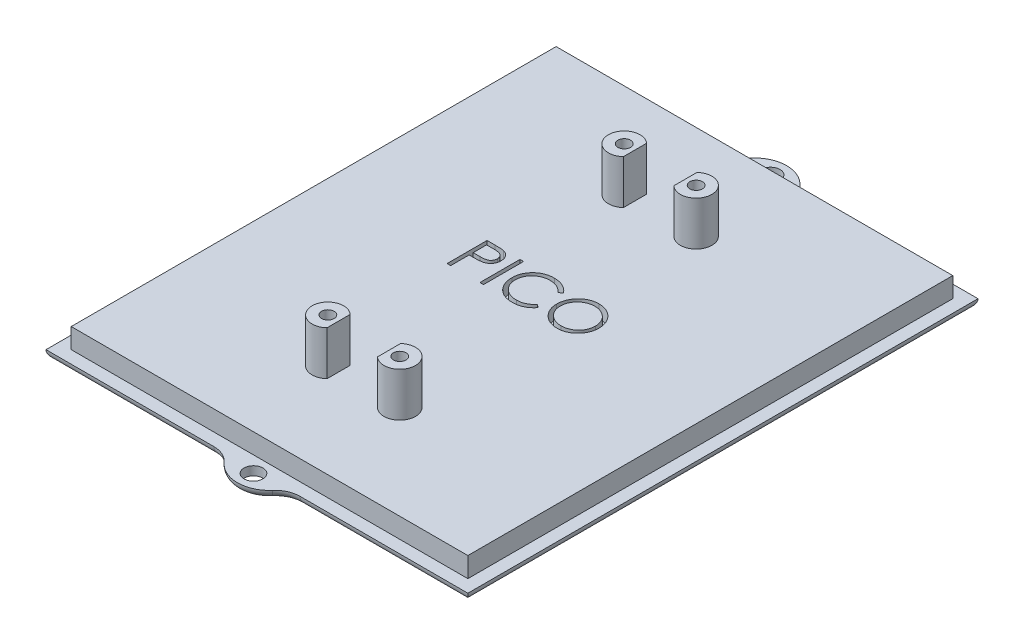
from build123d import *

# Parameters (mm, degrees)
SKETCH1_W           = 62.9
SKETCH1_H           = 76.9
BOSS_EXTRUDE1_DEPTH = 4.575
SKETCH11_W          = 66.9
SKETCH11_H          = 80.9
BOSS_EXTRUDE5_DEPTH = 1.4
BOSS_EXTRUDE3_DEPTH = 1.4
CUT_EXTRUDE3_REACH  = 57.005
SKETCH12_R          = 1.5
FILLET1_R           = 1.4
SKETCH2_R           = 2.5
SKETCH2_R_2         = 1
SCREW_HOLES_DEPTH   = 7
CUT_EXTRUDE1_START  = -3.575
SKETCH3_R           = 1
CUT_EXTRUDE1_DEPTH  = 3.575
SKETCH5_W           = 0.569871795
SKETCH5_H           = 6.35
LETTERS_DEPTH       = 2
SKETCH7_W           = 8
SKETCH7_H           = 52
CUT_EXTRUDE2_DEPTH  = 7


with BuildPart() as part:
    # Sketch1 → Boss-Extrude1 (new body)
    with BuildSketch(Plane(origin=(0, 0, 0), x_dir=(1, 0, 0), z_dir=(0, 1, 0))):
        Rectangle(SKETCH1_W, SKETCH1_H)
    extrude(amount=BOSS_EXTRUDE1_DEPTH)

    # Sketch11 → Boss-Extrude5 (add)
    with BuildSketch(Plane(origin=(0, 0, 0), x_dir=(-1, 0, 0), z_dir=(0, -1, 0))):
        Rectangle(SKETCH11_W, SKETCH11_H)
    extrude(amount=-BOSS_EXTRUDE5_DEPTH)

    # Sketch4 → Boss-Extrude3 (add)
    with BuildSketch(Plane(origin=(0, 0, 0), x_dir=(1, 0, 0), z_dir=(0, 1, 0))):
        with BuildLine():
            Line((-6.841783393, -40.45), (6.841783393, -40.45))
            ThreePointArc((6.841783393, -40.45), (5.190942782, -40.806550361), (3.834406078, -41.812637363))
            ThreePointArc((3.834406078, -41.812637363), (0, -43.55), (-3.834406078, -41.812637363))
            ThreePointArc((-3.834406078, -41.812637363), (-5.190942782, -40.806550361), (-6.841783393, -40.45))
        make_face()
    boss_extrude3 = extrude(amount=BOSS_EXTRUDE3_DEPTH)

    # Sketch12 → Cut-Extrude3 (cut, up to next)
    with BuildSketch(Plane(origin=(0, 1.4, 0), x_dir=(1, 0, 0), z_dir=(0, 1, 0)), mode=Mode.PRIVATE) as cut_extrude3_sk1:
        with Locations(Location((0, -41, 0), (0, 0, 270))):
            Circle(SKETCH12_R)
    cut_extrude3_tool1 = extrude(cut_extrude3_sk1.sketch, amount=-CUT_EXTRUDE3_REACH, mode=Mode.PRIVATE) & part.part
    cut_extrude3 = cut_extrude3_tool1.solids().sort_by_distance((0, 1.4, 41))[0]
    add(cut_extrude3, mode=Mode.SUBTRACT)

    # Mirror1: Boss-Extrude3, Cut-Extrude3 across plane
    add(boss_extrude3.mirror(Plane.XY))
    add(cut_extrude3.mirror(Plane.XY), mode=Mode.SUBTRACT)

    # Fillet1
    # the kernel refuses this fillet: 1.4 mm, written as the material it takes off along each edge
    with BuildSketch(Plane(origin=(6.841783393, 0, -40.45), x_dir=(0, 0, 1), z_dir=(1, 0, 0)), Plane(origin=(-36.95, 0, -40.45), x_dir=(0, 0, 1), z_dir=(1, 0, 0)), Plane(origin=(-6.841783393, 0, 40.45), x_dir=(0, 0, -1), z_dir=(-1, 0, 0)), Plane(origin=(36.95, 0, 40.45), x_dir=(0, 0, -1), z_dir=(-1, 0, 0))) as fillet1_piece_1:
        with BuildLine():
            CenterArc((FILLET1_R, -FILLET1_R), FILLET1_R, 90, 90)
            Line((0, -FILLET1_R), (0, 0))
            Line((0, 0), (FILLET1_R, 0))
        make_face()
    extrude(amount=30.108216607, mode=Mode.SUBTRACT)
    with BuildSketch(Plane(origin=(6.841783393, 0, -44.45), x_dir=(0, 0, 1), z_dir=(1, 0, 0))) as fillet1_piece_2:
        with BuildLine():
            CenterArc((4 + FILLET1_R, -FILLET1_R), FILLET1_R, 90, 90)
            Line((4, -FILLET1_R), (4, 0))
            Line((4, 0), (4 + FILLET1_R, 0))
        make_face()
    revolve(axis=Axis((6.841783393, 0, -44.45), (0, -1, 0)), revolution_arc=48.750392906, mode=Mode.SUBTRACT)
    with BuildSketch(Plane(origin=(0, 0, -38.45), x_dir=(0.7518443289273548, 0, -0.6593406593406594), z_dir=(0.6593406593406594, 0, 0.7518443289273548))) as fillet1_piece_3:
        with BuildLine():
            CenterArc((5.1 - FILLET1_R, FILLET1_R), FILLET1_R, 270, 90)
            Line((5.1, FILLET1_R), (5.1, 0))
            Line((5.1, 0), (5.1 - FILLET1_R, 0))
        make_face()
    revolve(axis=Axis((0, 0, -38.45), (0, 1, 0)), revolution_arc=97.500785812, mode=Mode.SUBTRACT)
    with BuildSketch(Plane(origin=(-6.841783393, 0, -44.45), x_dir=(0.7518443289273578, 0, 0.6593406593406562), z_dir=(0.6593406593406562, 0, -0.7518443289273578))) as fillet1_piece_4:
        with BuildLine():
            CenterArc((4 + FILLET1_R, -FILLET1_R), FILLET1_R, 90, 90)
            Line((4, -FILLET1_R), (4, 0))
            Line((4, 0), (4 + FILLET1_R, 0))
        make_face()
    revolve(axis=Axis((-6.841783393, 0, -44.45), (0, -1, 0)), revolution_arc=48.750392906, mode=Mode.SUBTRACT)
    with BuildSketch(Plane(origin=(-33.45, 0, 43.95), x_dir=(1, 0, 0), z_dir=(0, 0, -1)), Plane(origin=(33.45, 0, -43.95), x_dir=(-1, 0, 0), z_dir=(0, 0, 1))) as fillet1_piece_5:
        with BuildLine():
            CenterArc((FILLET1_R, -FILLET1_R), FILLET1_R, 90, 90)
            Line((0, -FILLET1_R), (0, 0))
            Line((0, 0), (FILLET1_R, 0))
        make_face()
    extrude(amount=87.9, mode=Mode.SUBTRACT)
    with BuildSketch(Plane(origin=(-6.841783393, 0, 44.45), x_dir=(0.7518443289273578, 0, -0.6593406593406562), z_dir=(0.6593406593406562, 0, 0.7518443289273578))) as fillet1_piece_6:
        with BuildLine():
            CenterArc((4 + FILLET1_R, FILLET1_R), FILLET1_R, 180, 90)
            Line((4, FILLET1_R), (4, 0))
            Line((4, 0), (4 + FILLET1_R, 0))
        make_face()
    revolve(axis=Axis((-6.841783393, 0, 44.45), (0, 1, 0)), revolution_arc=48.750392906, mode=Mode.SUBTRACT)
    with BuildSketch(Plane(origin=(0, 0, 38.45), x_dir=(0.7518443289273548, 0, 0.6593406593406594), z_dir=(0.6593406593406594, 0, -0.7518443289273548))) as fillet1_piece_7:
        with BuildLine():
            CenterArc((5.1 - FILLET1_R, -FILLET1_R), FILLET1_R, 0, 90)
            Line((5.1, -FILLET1_R), (5.1, 0))
            Line((5.1, 0), (5.1 - FILLET1_R, 0))
        make_face()
    revolve(axis=Axis((0, 0, 38.45), (0, -1, 0)), revolution_arc=97.500785812, mode=Mode.SUBTRACT)
    with BuildSketch(Plane(origin=(6.841783393, 0, 44.45), x_dir=(0, 0, -1), z_dir=(1, 0, 0))) as fillet1_piece_8:
        with BuildLine():
            CenterArc((4 + FILLET1_R, FILLET1_R), FILLET1_R, 180, 90)
            Line((4, FILLET1_R), (4, 0))
            Line((4, 0), (4 + FILLET1_R, 0))
        make_face()
    revolve(axis=Axis((6.841783393, 0, 44.45), (0, 1, 0)), revolution_arc=48.750392906, mode=Mode.SUBTRACT)

    # Sketch2 → Screw_Holes (add)
    # profile 1 of 4: a face of its own
    with BuildSketch(Plane(origin=(0, 4.575, 0), x_dir=(1, 0, 0), z_dir=(0, 1, 0))):
        with Locations(Location((-5.7, -23.5, 0), (0, 0, 270))):
            Circle(SKETCH2_R)
        with Locations(Location((-5.7, -23.5, 0), (0, 0, 270))):
            Circle(SKETCH2_R_2, mode=Mode.SUBTRACT)
    # profile 2 of 4: a face of its own
    with BuildSketch(Plane(origin=(0, 4.575, 0), x_dir=(1, 0, 0), z_dir=(0, 1, 0))):
        with Locations(Location((5.7, -23.5, 0), (0, 0, 270))):
            Circle(SKETCH2_R)
        with Locations(Location((5.7, -23.5, 0), (0, 0, 270))):
            Circle(SKETCH2_R_2, mode=Mode.SUBTRACT)
    # profile 3 of 4: a face of its own
    with BuildSketch(Plane(origin=(0, 4.575, 0), x_dir=(1, 0, 0), z_dir=(0, 1, 0))):
        with Locations(Location((5.7, 23.5, 0), (0, 0, 270))):
            Circle(SKETCH2_R)
        with Locations(Location((5.7, 23.5, 0), (0, 0, 270))):
            Circle(SKETCH2_R_2, mode=Mode.SUBTRACT)
    # profile 4 of 4: a face of its own
    with BuildSketch(Plane(origin=(0, 4.575, 0), x_dir=(1, 0, 0), z_dir=(0, 1, 0))):
        with Locations(Location((-5.7, 23.5, 0), (0, 0, 270))):
            Circle(SKETCH2_R)
        with Locations(Location((-5.7, 23.5, 0), (0, 0, 270))):
            Circle(SKETCH2_R_2, mode=Mode.SUBTRACT)
    extrude(amount=SCREW_HOLES_DEPTH)

    # Sketch3 → Cut-Extrude1 (cut)
    with BuildSketch(Plane(origin=(0, 4.575, 0), x_dir=(1, 0, 0), z_dir=(0, 1, 0)).offset(CUT_EXTRUDE1_START)):
        with Locations(Location((5.7, -23.5, 0), (0, 0, 270))):
            Circle(SKETCH3_R)
        with Locations(Location((-5.7, -23.5, 0), (0, 0, 270))):
            Circle(SKETCH3_R)
        with Locations(Location((-5.7, 23.5, 0), (0, 0, 270))):
            Circle(SKETCH3_R)
        with Locations(Location((5.7, 23.5, 0), (0, 0, 270))):
            Circle(SKETCH3_R)
    extrude(amount=CUT_EXTRUDE1_DEPTH, mode=Mode.SUBTRACT)

    # Sketch5 → Letters (cut)
    # profile 1 of 4: a face of its own
    with BuildSketch(Plane(origin=(0, 4.575, 0), x_dir=(1, 0, 0), z_dir=(0, 1, 0))):
        with BuildLine():
            Line((-10.298397436, 6.35), (-9.05307492, 6.35))
            add(Edge.make_bspline(
                [(-9.05307492, 6.35), (-8.967420847, 6.349905845), (-8.80330384, 6.349725441), (-8.567963668, 6.344255831), (-8.354223155, 6.336950261), (-8.162543178, 6.326823112), (-7.992333971, 6.314855012), (-7.844365728, 6.298069169), (-7.71747539, 6.280542633), (-7.641445117, 6.262723796), (-7.606770833, 6.254597356)],
                knots=[0, 0, 0, 0, 1.415646017, 2.712440637, 3.8905458, 4.950247383, 5.884950622, 6.709939814, 7.411656543, 8, 8, 8, 8], degree=3))
            add(Edge.make_bspline(
                [(-7.606770833, 6.254597356), (-7.562876851, 6.242583247), (-7.476123192, 6.218838126), (-7.351117014, 6.171278942), (-7.232183608, 6.114887014), (-7.118914924, 6.050617866), (-7.012702859, 5.975714057), (-6.911962756, 5.893211922), (-6.817583649, 5.801206647), (-6.730096266, 5.700730162), (-6.649750991, 5.59346921), (-6.580572852, 5.477822593), (-6.52264774, 5.355736942), (-6.472966662, 5.227297177), (-6.437209895, 5.091424733), (-6.410273376, 4.949063698), (-6.393176224, 4.800229332), (-6.391538719, 4.698520715), (-6.390705128, 4.646744792)],
                knots=[0, 0, 0, 0, 0.999701418, 1.975846123, 2.934577507, 3.890451536, 4.834027766, 5.787354733, 6.749476667, 7.726910423, 8.712836071, 9.690891519, 10.682875813, 11.679750201, 12.712814741, 13.765529915, 14.8625177, 16, 16, 16, 16], degree=3))
            add(Edge.make_bspline(
                [(-6.390705128, 4.646744792), (-6.391469713, 4.594533682), (-6.392965675, 4.492379121), (-6.410920364, 4.342931348), (-6.43510514, 4.200113697), (-6.47229265, 4.064242837), (-6.520998371, 3.936125653), (-6.578133952, 3.813804275), (-6.647046929, 3.699359728), (-6.72623112, 3.592376529), (-6.814317584, 3.492754259), (-6.910933629, 3.401214846), (-7.015689202, 3.318294118), (-7.128251385, 3.24380618), (-7.24971754, 3.179478359), (-7.378245447, 3.121861534), (-7.514952268, 3.07347261), (-7.609553686, 3.04801807), (-7.657652244, 3.035076122)],
                knots=[0, 0, 0, 0, 1.121902311, 2.195077645, 3.232258892, 4.234102512, 5.217864754, 6.176164875, 7.132989551, 8.084763148, 9.034132444, 9.988522005, 10.94243251, 11.903244335, 12.886203696, 13.894208494, 14.929344452, 16, 16, 16, 16], degree=3))
            add(Edge.make_bspline(
                [(-7.657652244, 3.035076122), (-7.697434692, 3.026616142), (-7.784620242, 3.008075604), (-7.928207752, 2.987377404), (-8.09538581, 2.969710614), (-8.285926232, 2.956464264), (-8.499657988, 2.94512431), (-8.736696698, 2.936110768), (-8.997507666, 2.931158033), (-9.179428352, 2.930902595), (-9.274409054, 2.930769231)],
                knots=[0, 0, 0, 0, 0.601384939, 1.31797006, 2.144135048, 3.087295005, 4.142315834, 5.309527816, 6.595305764, 8, 8, 8, 8], degree=3))
            Line((-9.274409054, 2.930769231), (-9.728525641, 2.930769231))
            Line((-9.728525641, 2.930769231), (-9.728525641, 0))
            Line((-9.728525641, 0), (-10.298397436, 0))
            Line((-10.298397436, 0), (-10.298397436, 6.35))
        make_face()
        with BuildLine():
            Line((-9.728525641, 5.698717949), (-9.728525641, 3.582051282))
            Line((-9.728525641, 3.582051282), (-8.616766827, 3.568058894))
            add(Edge.make_bspline(
                [(-8.616766827, 3.568058894), (-8.562483533, 3.568030839), (-8.457690753, 3.567976679), (-8.306313605, 3.575207013), (-8.165871041, 3.583553693), (-8.036794454, 3.595774583), (-7.919025659, 3.613048864), (-7.812368285, 3.630487303), (-7.717649358, 3.655715604), (-7.606797949, 3.689684601), (-7.483275304, 3.747619489), (-7.348895609, 3.831711433), (-7.235011831, 3.938900717), (-7.136462921, 4.059419783), (-7.058256542, 4.193493918), (-7.001004956, 4.33694756), (-6.967365999, 4.488309516), (-6.962855334, 4.59188371), (-6.960576923, 4.644200721)],
                knots=[0, 0, 0, 0, 1.160613943, 2.240541288, 3.23993089, 4.169200891, 5.011653406, 5.7853311, 6.478053781, 7.106038997, 8.262395093, 9.384106736, 10.481365981, 11.59014053, 12.70357646, 13.786202915, 14.881775077, 16, 16, 16, 16], degree=3))
            add(Edge.make_bspline(
                [(-6.960576923, 4.644200721), (-6.962867725, 4.695252024), (-6.967421554, 4.796735696), (-7.00126862, 4.94546859), (-7.058145233, 5.087410511), (-7.136987911, 5.219804537), (-7.23267539, 5.339889939), (-7.343889913, 5.444206155), (-7.470369687, 5.52806553), (-7.588022906, 5.582191627), (-7.692527915, 5.615239341), (-7.783300185, 5.638362123), (-7.885790409, 5.65682358), (-8.000031951, 5.671772392), (-8.12513935, 5.684569386), (-8.262187436, 5.693252516), (-8.410657045, 5.698335158), (-8.513727653, 5.698587263), (-8.567157452, 5.698717949)],
                knots=[0, 0, 0, 0, 1.120700087, 2.227813068, 3.331159281, 4.466773991, 5.599788987, 6.693661531, 7.80175334, 8.91857717, 9.525282508, 10.207424825, 10.974604443, 11.810962634, 12.737642355, 13.736264703, 14.826523623, 16, 16, 16, 16], degree=3))
            Line((-8.567157452, 5.698717949), (-9.728525641, 5.698717949))
        make_face(mode=Mode.SUBTRACT)
    # profile 2 of 4: a face of its own
    with BuildSketch(Plane(origin=(0, 4.575, 0), x_dir=(1, 0, 0), z_dir=(0, 1, 0))):
        with Locations((-4.803205129, 3.175)):
            Rectangle(SKETCH5_W, SKETCH5_H)
    # profile 3 of 4: a face of its own
    with BuildSketch(Plane(origin=(0, 4.575, 0), x_dir=(1, 0, 0), z_dir=(0, 1, 0))):
        with BuildLine():
            Line((2.971474359, 5.184815705), (2.472836538, 4.803205128))
            add(Edge.make_bspline(
                [(2.472836538, 4.803205128), (2.437265855, 4.845597673), (2.366604059, 4.929811221), (2.252922363, 5.048065537), (2.134446525, 5.158855368), (2.011221834, 5.262708493), (1.881030288, 5.355993196), (1.747025697, 5.443570769), (1.606966386, 5.522070808), (1.413288239, 5.617253654), (1.159927143, 5.716578821), (0.840985077, 5.799860398), (0.508043513, 5.852875959), (0.280899297, 5.858617886), (0.165364583, 5.861538462)],
                knots=[0, 0, 0, 0, 0.757959112, 1.505699292, 2.245454638, 2.979532153, 3.711538275, 4.438200793, 5.171680507, 5.909471876, 7.393775596, 8.890124382, 10.418191784, 12, 12, 12, 12], degree=3))
            add(Edge.make_bspline(
                [(0.165364583, 5.861538462), (0.101713455, 5.860805558), (-0.024998061, 5.859346553), (-0.213046005, 5.840098569), (-0.397582541, 5.813045374), (-0.57848763, 5.772903716), (-0.755530997, 5.722153393), (-0.92987007, 5.661510142), (-1.098980729, 5.586480646), (-1.26520239, 5.503552803), (-1.424458959, 5.409885868), (-1.575144545, 5.307717358), (-1.716709573, 5.198190569), (-1.849266026, 5.08089499), (-1.972949418, 4.956358862), (-2.086863539, 4.823254985), (-2.190614212, 4.682008899), (-2.286257958, 4.534483145), (-2.371915345, 4.381107437), (-2.443633841, 4.221314095), (-2.507143134, 4.057839508), (-2.557397474, 3.888836688), (-2.597174812, 3.715494813), (-2.624620715, 3.537348669), (-2.643649799, 3.354770422), (-2.645101548, 3.23101924), (-2.645833333, 3.168639824)],
                knots=[0, 0, 0, 0, 1.054917814, 2.100044995, 3.131103042, 4.146048494, 5.169673617, 6.183595914, 7.203665975, 8.234915748, 9.262203917, 10.264457458, 11.251630812, 12.227803204, 13.197192746, 14.159520551, 15.12972552, 16.100847026, 17.073214652, 18.039054194, 19.002613845, 19.979014051, 20.95965708, 21.949030935, 22.966165397, 24, 24, 24, 24], degree=3))
            add(Edge.make_bspline(
                [(-2.645833333, 3.168639824), (-2.643544033, 3.074784429), (-2.639049296, 2.890511811), (-2.599047318, 2.620599417), (-2.53825951, 2.362026195), (-2.447154106, 2.116408481), (-2.334815257, 1.880717603), (-2.192864433, 1.658941397), (-2.028460144, 1.447728487), (-1.839276554, 1.252070568), (-1.631711717, 1.073338524), (-1.409011934, 0.915948183), (-1.171731869, 0.784748325), (-0.922491412, 0.675571964), (-0.659372605, 0.591649044), (-0.382848606, 0.53256842), (-0.093520844, 0.494029036), (0.104180782, 0.490339344), (0.204797676, 0.488461538)],
                knots=[0, 0, 0, 0, 1.029171465, 2.020641659, 2.987623507, 3.938342917, 4.889210282, 5.84687017, 6.821220943, 7.821438502, 8.827599549, 9.822697543, 10.807740252, 11.797342354, 12.80366471, 13.83203677, 14.896651826, 16, 16, 16, 16], degree=3))
            add(Edge.make_bspline(
                [(0.204797676, 0.488461538), (0.315655412, 0.491525467), (0.533849955, 0.497556013), (0.853831946, 0.548644936), (1.160148264, 0.631481444), (1.452815385, 0.747410532), (1.731008243, 0.898114697), (1.995162184, 1.080809417), (2.245500176, 1.297232535), (2.396033788, 1.462483354), (2.472836538, 1.546794872)],
                knots=[0, 0, 0, 0, 1.028121516, 2.023589091, 2.998037872, 3.967518031, 4.937445131, 5.927275754, 6.942489185, 8, 8, 8, 8], degree=3))
            Line((2.472836538, 1.546794872), (2.971474359, 1.169000401))
            add(Edge.make_bspline(
                [(2.971474359, 1.169000401), (2.931345788, 1.117223495), (2.85128086, 1.013917692), (2.721635601, 0.868281876), (2.585061076, 0.731295983), (2.440542859, 0.604064442), (2.289743437, 0.48404134), (2.129955099, 0.374636589), (1.963278426, 0.274323127), (1.790278157, 0.182471421), (1.611138102, 0.100978702), (1.426072913, 0.03121258), (1.235880297, -0.028885434), (1.040551561, -0.078328233), (0.839681545, -0.116920057), (0.633995113, -0.14271861), (0.42304834, -0.160393226), (0.28073319, -0.162004159), (0.208613782, -0.162820513)],
                knots=[0, 0, 0, 0, 0.986787822, 1.968848986, 2.935600012, 3.899624008, 4.868462664, 5.837806735, 6.815139263, 7.798259679, 8.787526145, 9.778297419, 10.776456485, 11.791383307, 12.812564526, 13.85620153, 14.913611965, 16, 16, 16, 16], degree=3))
            add(Edge.make_bspline(
                [(0.208613782, -0.162820513), (0.140317415, -0.162345183), (0.005269805, -0.161405279), (-0.19411793, -0.146179489), (-0.388227598, -0.125406395), (-0.576504419, -0.094127871), (-0.759975831, -0.057217426), (-0.936978605, -0.007739575), (-1.109254487, 0.047685342), (-1.276111334, 0.112827246), (-1.437691075, 0.186335178), (-1.593472561, 0.269414149), (-1.743384146, 0.361365532), (-1.888899695, 0.460162479), (-2.027869597, 0.568978441), (-2.161498136, 0.686302192), (-2.290534628, 0.811738298), (-2.370368071, 0.902189246), (-2.410506811, 0.947666266)],
                knots=[0, 0, 0, 0, 1.114604814, 2.203992996, 3.262667896, 4.300477797, 5.318619304, 6.316056647, 7.298880507, 8.271930387, 9.238335007, 10.195173496, 11.151986948, 12.108099108, 13.064862484, 14.031167946, 15.010108607, 16, 16, 16, 16], degree=3))
            add(Edge.make_bspline(
                [(-2.410506811, 0.947666266), (-2.474797193, 1.026662423), (-2.602601786, 1.183701026), (-2.766115527, 1.438219878), (-2.906083234, 1.703955057), (-3.019250976, 1.982302642), (-3.107720506, 2.272638045), (-3.169009246, 2.575107621), (-3.208835728, 2.889428887), (-3.213390109, 3.10321849), (-3.215705128, 3.211889022)],
                knots=[0, 0, 0, 0, 0.994628077, 1.977248131, 2.950237994, 3.925870899, 4.908910175, 5.911660606, 6.938484602, 8, 8, 8, 8], degree=3))
            add(Edge.make_bspline(
                [(-3.215705128, 3.211889022), (-3.212883563, 3.326108202), (-3.207332309, 3.550827308), (-3.160168509, 3.880617195), (-3.084297264, 4.19657759), (-2.976534338, 4.49811867), (-2.839908914, 4.786826464), (-2.671132058, 5.060495507), (-2.472164528, 5.320875986), (-2.244566799, 5.564017035), (-1.994980347, 5.786338432), (-1.727701928, 5.981929687), (-1.443254681, 6.144702895), (-1.144772293, 6.280767361), (-0.830019699, 6.385350887), (-0.499668444, 6.458563097), (-0.15433927, 6.504132722), (0.081268274, 6.509893457), (0.200981571, 6.512820513)],
                knots=[0, 0, 0, 0, 1.032925535, 2.032216505, 3.007276963, 3.968222605, 4.92396291, 5.891752235, 6.871517503, 7.883894988, 8.900124299, 9.891468569, 10.874487609, 11.85992873, 12.854644235, 13.869047385, 14.917252991, 16, 16, 16, 16], degree=3))
            add(Edge.make_bspline(
                [(0.200981571, 6.512820513), (0.273942112, 6.511945776), (0.418360158, 6.510214324), (0.631997113, 6.493330323), (0.839991049, 6.465184209), (1.042485259, 6.426873625), (1.240464863, 6.379326056), (1.432416728, 6.317385801), (1.619467203, 6.246562379), (1.800436594, 6.164994877), (1.97445662, 6.073433789), (2.141473084, 5.972894015), (2.300159327, 5.863500196), (2.451631952, 5.746182721), (2.593357078, 5.61845962), (2.729358618, 5.483843982), (2.855018003, 5.33845833), (2.932584513, 5.236123664), (2.971474359, 5.184815705)],
                knots=[0, 0, 0, 0, 1.096760587, 2.17092713, 3.219439832, 4.250915756, 5.268269357, 6.278326846, 7.281116186, 8.274029601, 9.260640565, 10.235837813, 11.203064059, 12.156899882, 13.114053108, 14.069676657, 15.032185724, 16, 16, 16, 16], degree=3))
        make_face()
    # profile 4 of 4: a face of its own
    with BuildSketch(Plane(origin=(0, 4.575, 0), x_dir=(1, 0, 0), z_dir=(0, 1, 0))):
        with BuildLine():
            add(Edge.make_bspline(
                [(7.245512821, 6.512820513), (7.363093241, 6.5098424), (7.594030888, 6.503993141), (7.933438203, 6.459218196), (8.257460733, 6.38175656), (8.568737985, 6.278590864), (8.863546671, 6.140969336), (9.144105804, 5.974626281), (9.409747847, 5.777818991), (9.656892353, 5.552068823), (9.883055677, 5.306444556), (10.082311214, 5.044320348), (10.249302233, 4.767281093), (10.386436446, 4.4761593), (10.494021067, 4.171613358), (10.568259903, 3.852019667), (10.615681976, 3.519448958), (10.621226029, 3.292614503), (10.624038462, 3.177544071)],
                knots=[0, 0, 0, 0, 1.065120563, 2.091984664, 3.0946048, 4.079830382, 5.057816894, 6.036188127, 7.030412546, 8.04752943, 9.064399622, 10.05169764, 11.02544977, 11.989514704, 12.962713494, 13.945757189, 14.957906945, 16, 16, 16, 16], degree=3))
            add(Edge.make_bspline(
                [(10.624038462, 3.177544071), (10.621226441, 3.063321275), (10.615683623, 2.838174912), (10.568205984, 2.507714663), (10.493745884, 2.190050114), (10.387435515, 1.885711573), (10.250955004, 1.594377993), (10.082852051, 1.316815948), (9.884838711, 1.052934444), (9.659491996, 0.805624322), (9.41383582, 0.578843197), (9.150346621, 0.381233237), (8.87495017, 0.211190896), (8.584102556, 0.075511945), (8.281661061, -0.032931396), (7.964918846, -0.106868311), (7.635360098, -0.154560518), (7.410622705, -0.160036968), (7.296394231, -0.162820513)],
                knots=[0, 0, 0, 0, 1.043624062, 2.057103931, 3.04512605, 4.022047818, 4.998200453, 5.980619268, 6.982898556, 8.009068085, 9.034988726, 10.034168286, 11.015286542, 11.987931943, 12.962482838, 13.94673481, 14.956375938, 16, 16, 16, 16], degree=3))
            add(Edge.make_bspline(
                [(7.296394231, -0.162820513), (7.181324395, -0.160009482), (6.954491117, -0.154468193), (6.621502496, -0.106967644), (6.301684304, -0.032688422), (5.995951124, 0.073464412), (5.704132466, 0.210655674), (5.425657601, 0.377940762), (5.161644291, 0.576436575), (4.914281408, 0.801710217), (4.68795072, 1.046950033), (4.490630139, 1.309720753), (4.323307433, 1.584867082), (4.186576816, 1.87315259), (4.078328439, 2.173183636), (4.004478269, 2.486961588), (3.956697328, 2.812697548), (3.951191249, 3.034481092), (3.948397436, 3.147015224)],
                knots=[0, 0, 0, 0, 1.053102029, 2.075944431, 3.073151272, 4.055350789, 5.033113405, 6.020478099, 7.024410459, 8.052272461, 9.079885166, 10.07527673, 11.055994387, 12.023226415, 12.992069828, 13.970394897, 14.97016774, 16, 16, 16, 16], degree=3))
            add(Edge.make_bspline(
                [(3.948397436, 3.147015224), (3.949367417, 3.222548781), (3.951295144, 3.372663005), (3.974502929, 3.595578123), (4.008179158, 3.814908316), (4.056442628, 4.030029893), (4.119564652, 4.240416251), (4.194044759, 4.447518349), (4.285012764, 4.649237391), (4.387847654, 4.846528973), (4.502622649, 5.036317602), (4.629397223, 5.215713417), (4.763718534, 5.386221797), (4.91097212, 5.543424219), (5.066304813, 5.691893852), (5.232236442, 5.829349067), (5.407754514, 5.957029336), (5.59361426, 6.072091954), (5.785235988, 6.176157813), (5.98276957, 6.265460314), (6.183532207, 6.34210674), (6.388464211, 6.40422938), (6.597021383, 6.453273217), (6.809658907, 6.486669416), (7.02620738, 6.509936392), (7.172096487, 6.511855003), (7.245512821, 6.512820513)],
                knots=[0, 0, 0, 0, 1.037015668, 2.060948919, 3.074880161, 4.083647147, 5.086022904, 6.090072063, 7.104153813, 8.122640571, 9.144368836, 10.147691507, 11.138137339, 12.123020368, 13.103399296, 14.087645067, 15.080126199, 16.082011238, 17.087798457, 18.072939717, 19.057185487, 20.037253025, 21.01195951, 21.997135196, 22.992090687, 24, 24, 24, 24], degree=3))
        make_face()
        with BuildLine():
            add(Edge.make_bspline(
                [(7.273497596, 5.861538462), (7.213236761, 5.860803875), (7.093291188, 5.859341724), (6.914974958, 5.840081783), (6.739003878, 5.812631842), (6.565341607, 5.773476797), (6.394714768, 5.720129444), (6.225532913, 5.658732368), (6.059338801, 5.583945532), (5.896681087, 5.49944934), (5.738992308, 5.405924869), (5.590197836, 5.302561806), (5.449912467, 5.191784144), (5.318479684, 5.073333353), (5.196285414, 4.946606218), (5.080924599, 4.813523941), (4.977021215, 4.670282653), (4.881797382, 4.520766629), (4.796584301, 4.365170618), (4.720810014, 4.205132725), (4.658826741, 4.039347493), (4.60827643, 3.869613521), (4.566366773, 3.69619963), (4.539816654, 3.517790305), (4.520345087, 3.33528203), (4.518966511, 3.211943523), (4.518269231, 3.149559295)],
                knots=[0, 0, 0, 0, 1.008559885, 2.007477868, 2.99961109, 3.989939068, 4.984837346, 5.991145699, 7.001802488, 8.033829008, 9.059044045, 10.069351652, 11.065060232, 12.050310815, 13.029377138, 14.011219647, 14.996725999, 15.989392538, 16.977580475, 17.965360261, 18.951710183, 19.937753436, 20.929683414, 21.935841486, 22.955955122, 24, 24, 24, 24], degree=3))
            add(Edge.make_bspline(
                [(4.518269231, 3.149559295), (4.520582195, 3.05782498), (4.52513251, 2.877355204), (4.564969816, 2.612890143), (4.626332541, 2.358729966), (4.716788049, 2.116265359), (4.829909878, 1.88341216), (4.969658665, 1.662236027), (5.13522872, 1.452677184), (5.323303975, 1.256198625), (5.528903743, 1.076864094), (5.747221696, 0.919450481), (5.975918955, 0.786263314), (6.215591909, 0.677759825), (6.464961015, 0.591781301), (6.725633143, 0.532855784), (6.995871834, 0.494074601), (7.180077452, 0.490350315), (7.273497596, 0.488461538)],
                knots=[0, 0, 0, 0, 1.032063989, 2.030389145, 3.003944642, 3.970395727, 4.937377036, 5.913328081, 6.909231446, 7.93887556, 8.970685674, 9.976071282, 10.964166581, 11.944589148, 12.933237628, 13.927779006, 14.949070134, 16, 16, 16, 16], degree=3))
            add(Edge.make_bspline(
                [(7.273497596, 0.488461538), (7.336289121, 0.489324239), (7.460823572, 0.491035234), (7.64605402, 0.508268548), (7.827947433, 0.535903511), (8.006248683, 0.575691986), (8.180755412, 0.62548906), (8.352195984, 0.684648795), (8.518744311, 0.758456122), (8.682501445, 0.840004549), (8.839248912, 0.932968834), (8.988883092, 1.032823763), (9.12763237, 1.143438261), (9.258966828, 1.260129149), (9.381662778, 1.385249273), (9.494890506, 1.518635961), (9.598268746, 1.661131154), (9.693456419, 1.81042039), (9.77837091, 1.966442163), (9.852355847, 2.127060293), (9.915123086, 2.291879277), (9.965793373, 2.461136842), (10.005499854, 2.634511525), (10.032859137, 2.812235467), (10.051997018, 2.993953131), (10.053439516, 3.116859841), (10.054166667, 3.178816106)],
                knots=[0, 0, 0, 0, 1.047197238, 2.076906641, 3.100256066, 4.114471768, 5.12198147, 6.126382909, 7.136867548, 8.15857795, 9.17633901, 10.174870724, 11.156907918, 12.133735059, 13.104061851, 14.077631395, 15.04955518, 16.038496417, 17.029181396, 18.010275684, 18.986308667, 19.968651475, 20.955262928, 21.950658345, 22.966943676, 24, 24, 24, 24], degree=3))
            add(Edge.make_bspline(
                [(10.054166667, 3.178816106), (10.053438933, 3.240348521), (10.05199534, 3.3624094), (10.032868278, 3.542859742), (10.005470949, 3.719304854), (9.965987179, 3.89105204), (9.915096185, 4.058145078), (9.852344886, 4.220427035), (9.7783487, 4.378502474), (9.693425207, 4.531980699), (9.59796507, 4.679254866), (9.493654086, 4.820047815), (9.37869124, 4.951715503), (9.256361166, 5.077508448), (9.123608274, 5.194743762), (8.981033912, 5.303460335), (8.830368954, 5.406281847), (8.670843827, 5.499038223), (8.506208368, 5.584698331), (8.337273044, 5.658088008), (8.165951678, 5.720448853), (7.992679931, 5.773638204), (7.815999384, 5.812478488), (7.637103866, 5.840106521), (7.456240883, 5.859335021), (7.334605327, 5.860801651), (7.273497596, 5.861538462)],
                knots=[0, 0, 0, 0, 1.02996197, 2.043119294, 3.035359645, 4.018872909, 4.991431989, 5.957985074, 6.929999688, 7.912076566, 8.892894881, 9.867085534, 10.843653904, 11.817741046, 12.803660682, 13.806313499, 14.818574707, 15.856120519, 16.894564902, 17.924820532, 18.937903209, 19.946497019, 20.957711757, 21.963978472, 22.977135795, 24, 24, 24, 24], degree=3))
        make_face(mode=Mode.SUBTRACT)
    extrude(amount=-LETTERS_DEPTH, mode=Mode.SUBTRACT)

    # Sketch7 → Cut-Extrude2 (cut)
    with BuildSketch(Plane(origin=(0, 4.575, 0), x_dir=(1, 0, 0), z_dir=(0, 1, 0))):
        Rectangle(SKETCH7_W, SKETCH7_H)
    extrude(amount=CUT_EXTRUDE2_DEPTH, mode=Mode.SUBTRACT)


solid = part.part
